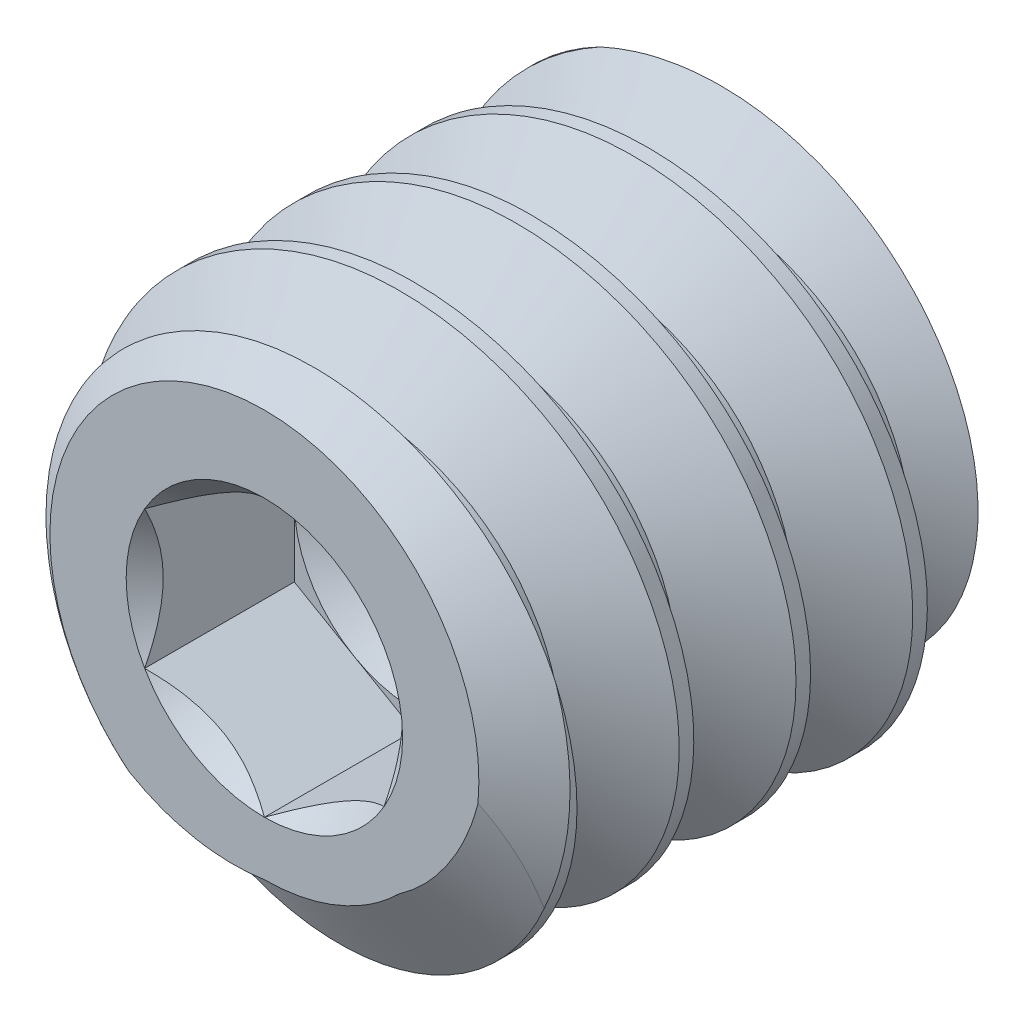
from build123d import *

# Parameters (mm, degrees)
CUT_SWEEP2_PITCH    = 0.619512195
CUT_EXTRUDE10_DEPTH = 0.79375


with BuildPart() as part:
    # Sketch22 → Revolve1 (revolve)
    with BuildSketch(Plane(origin=(0, 0, 0), x_dir=(0, 0, -1), z_dir=(1, 0, 0)), mode=Mode.PRIVATE) as revolve1_sk:
        Polygon((-1.5875, 0), (-1.5875, 1.13792), (-1.38830496, 1.4224), (0.843942194, 1.4224), (1.5875, 0.184912), (1.5875, 0), align=None)
    revolve(revolve1_sk.sketch.rotate(Axis((0, 0, -1.5875), (0, 0, 1)), 90), axis=Axis((0, 0, -1.5875), (0, 0, 1)))

    # Cut-Sweep2: the profile of Sketch28 profile screwed along a right-hand helix of 6.125 turns, 6 arcs to a turn; built about Z, then put on its axis
    cut_sweep2_z = Axis((0, 0, 0), (0, 0, 1))
    cut_sweep2_corners = [(1.4227, 0, 0.000173205), (1.4227, 0, -0.542246376), (1.020015026, 0, -0.309756098), (1.020015026, 0, -0.232317073)]
    with BuildLine(mode=Mode.PRIVATE) as cut_sweep2_profile:
        Line(cut_sweep2_corners[0], cut_sweep2_corners[1])
        Line(cut_sweep2_corners[1], cut_sweep2_corners[2])
        Line(cut_sweep2_corners[2], cut_sweep2_corners[3])
        Line(cut_sweep2_corners[3], cut_sweep2_corners[0])
    cut_sweep2_cap = Face(cut_sweep2_profile.wire())
    cut_sweep2_turn_angles = [0, 30, 60, 90, 120, 150, 180, 210, 240, 270, 300, 330, 360]
    cut_sweep2_turn_weights = [1, 0.8660254037844387, 1, 0.8660254037844387, 1, 0.8660254037844387, 1, 0.8660254037844387, 1, 0.8660254037844387, 1, 0.8660254037844387, 1]
    cut_sweep2_turn_rails = [Edge.make_bspline([Vector(p[0], p[1], 0).rotate(cut_sweep2_z, cut_sweep2_turn_angles[k]) / cut_sweep2_turn_weights[k] + Vector(0, 0, p[2] + CUT_SWEEP2_PITCH * cut_sweep2_turn_angles[k] / 360) for k in range(13)], [0, 0, 0, 1, 1, 2, 2, 3, 3, 4, 4, 5, 5, 6, 6, 6], 2, cut_sweep2_turn_weights) for p in cut_sweep2_corners]
    cut_sweep2_turn_sides = [Face.make_surface_from_curves(cut_sweep2_turn_rails[p[0]], cut_sweep2_turn_rails[p[1]]) for p in [(0, 1), (1, 2), (2, 3), (3, 0)]]
    cut_sweep2_last_angles = [2160, 2182.5, 2205]
    cut_sweep2_last_weights = [1, 0.9238795325112746, 1]
    cut_sweep2_last_rails = [Edge.make_bspline([Vector(p[0], p[1], 0).rotate(cut_sweep2_z, cut_sweep2_last_angles[k]) / cut_sweep2_last_weights[k] + Vector(0, 0, p[2] + CUT_SWEEP2_PITCH * cut_sweep2_last_angles[k] / 360) for k in range(3)], [0, 0, 0, 1, 1, 1], 2, cut_sweep2_last_weights) for p in cut_sweep2_corners]
    cut_sweep2_last_sides = [Face.make_surface_from_curves(cut_sweep2_last_rails[p[0]], cut_sweep2_last_rails[p[1]]) for p in [(0, 1), (1, 2), (2, 3), (3, 0)]]
    cut_sweep2 = Plane(origin=(0, 0, -1.5875), x_dir=(0, 1, 0), z_dir=(0, 0, 1)) * Solid(Shell([*[p.moved(Location((0, 0, CUT_SWEEP2_PITCH * i))) for i in range(6) for p in cut_sweep2_turn_sides], *cut_sweep2_last_sides, cut_sweep2_cap, cut_sweep2_cap.rotate(cut_sweep2_z, 2205).moved(Location((0, 0, CUT_SWEEP2_PITCH * 2205 / 360)))]))
    add(cut_sweep2, mode=Mode.SUBTRACT)

    # Sketch23 → Cut-Extrude10 (cut)
    with BuildSketch(Plane.XY.offset(1.5875)):
        Polygon((0, 0.733234842), (-0.635, 0.366617421), (-0.635, -0.366617421), (0, -0.733234842), (0.635, -0.366617421), (0.635, 0.366617421), align=None)
    extrude(amount=-CUT_EXTRUDE10_DEPTH, mode=Mode.SUBTRACT)

    # Cut-Extrude11 cone 1 section (through the dimple's axis) → Cut-Extrude11 (revolve, cut)
    with BuildSketch(Plane(origin=(0, 0, 1.5875), x_dir=(0, -1, 0), z_dir=(1, 0, 0))):
        Polygon((0, 0), (0.733234842, 0), (0, 0.733234842), align=None)
    revolve(axis=Axis((0, 0, 1.5875), (0, 0, -1)), mode=Mode.SUBTRACT)

    # Cut-Extrude12 cone 1 section (through the dimple's axis) → Cut-Extrude12 (revolve, cut)
    with BuildSketch(Plane(origin=(0, 0, 0.79375), x_dir=(0, -1, 0), z_dir=(1, 0, 0))):
        Polygon((0, 0), (0.635, 0), (0, 0.366617421), align=None)
    revolve(axis=Axis((0, 0, 0.79375), (0, 0, -1)), mode=Mode.SUBTRACT)


solid = part.part
